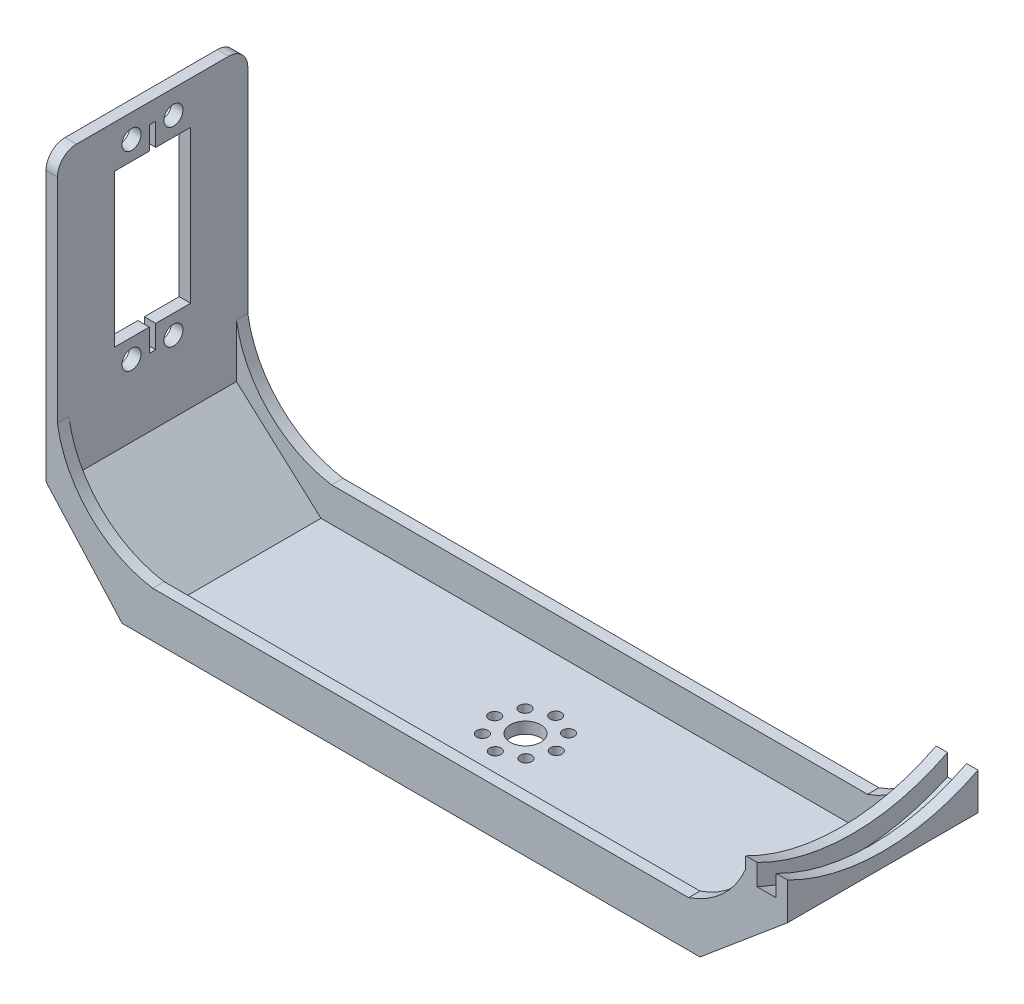
from build123d import *
from OCP.BRepFilletAPI import BRepFilletAPI_MakeChamfer

# Parameters (mm, degrees)
SKETCH1_W           = 194.75
SKETCH1_H           = 50
BOSS_EXTRUDE1_DEPTH = 3
BOSS_EXTRUDE2_START = -3
BOSS_EXTRUDE2_DEPTH = 5
BOSS_EXTRUDE3_DEPTH = 3
BOSS_EXTRUDE4_START = -3
BOSS_EXTRUDE4_DEPTH = 3
SKETCH6_W           = 50
SKETCH6_H           = 95
BOSS_EXTRUDE5_DEPTH = 3
BOSS_EXTRUDE6_REACH = 218.788
SKETCH7_W           = 3
SKETCH7_H           = 9
RIB1_START          = -3
RIB1_DEPTH          = 3
LPATTERN1_COUNT     = 2
LPATTERN1_PITCH     = 47
RIB2_START          = -3
RIB2_DEPTH          = 3
LPATTERN2_COUNT     = 2
LPATTERN2_PITCH     = 47
CUT_EXTRUDE1_REACH  = 178.602
SKETCH10_R          = 4
SKETCH10_R_2        = 1.5
FILLET1_R           = 5
CHAMFER1_SIZE       = 20
CHAMFER1_SIZE2      = 22.212250297
CHAMFER2_SIZE       = 20
CHAMFER2_SIZE2      = 14.004150764
CHAMFER3_SIZE       = 23
CHAMFER3_SIZE2      = 19.299291517
CUT_EXTRUDE2_REACH  = 221.446
SKETCH11_W          = 1.7
SKETCH11_H          = 6
SKETCH11_R          = 2.5


# Read off the part's stored shape, not the designer's step: Rib1, Rib2
with BuildPart() as part:
    # Sketch1 → Boss-Extrude1 (new body)
    with BuildSketch(Plane(origin=(0, 0, 0), x_dir=(1, 0, 0), z_dir=(0, 1, 0))):
        with Locations((49.3836315, 0)):
            Rectangle(SKETCH1_W, SKETCH1_H)
    extrude(amount=BOSS_EXTRUDE1_DEPTH)

    # Sketch2 → Boss-Extrude2 (add)
    with BuildSketch(Plane(origin=(146.7586315, 0, 0), x_dir=(0, 0, -1), z_dir=(1, 0, 0)).offset(BOSS_EXTRUDE2_START)):
        with BuildLine():
            Line((25, 3), (25, 23.456439427))
            ThreePointArc((25, 23.456439427), (0, 18), (-25, 23.456439427))
            Line((-25, 23.456439427), (-25, 3))
            Line((-25, 3), (25, 3))
        make_face()
    extrude(amount=-BOSS_EXTRUDE2_DEPTH)

    # Sketch3 → Boss-Extrude3 (add)
    with BuildSketch(Plane(origin=(143.7586315, 0, 0), x_dir=(0, 0, -1), z_dir=(1, 0, 0))):
        with BuildLine():
            Line((-25, 3), (25, 3))
            Line((25, 3), (25, 29.010205144))
            ThreePointArc((25, 29.010205144), (0, 23), (-25, 29.010205144))
            Line((-25, 29.010205144), (-25, 3))
        make_face()
    extrude(amount=BOSS_EXTRUDE3_DEPTH)

    # Sketch4 → Boss-Extrude4 (add)
    with BuildSketch(Plane(origin=(138.7586315, 0, 0), x_dir=(0, 0, -1), z_dir=(1, 0, 0)).offset(BOSS_EXTRUDE4_START)):
        with BuildLine():
            Line((-25, 0), (-25, 29.010205144))
            ThreePointArc((-25, 29.010205144), (0, 23), (25, 29.010205144))
            Line((25, 29.010205144), (25, 0))
            Line((25, 0), (-25, 0))
        make_face()
    extrude(amount=BOSS_EXTRUDE4_DEPTH)

    # Sketch6 → Boss-Extrude5 (add)
    with BuildSketch(Plane.ZY.offset(47.9913685)):
        with Locations((0, 50.5)):
            Rectangle(SKETCH6_W, SKETCH6_H)
    extrude(amount=-BOSS_EXTRUDE5_DEPTH)

    # Sketch7 → Boss-Extrude6 (add, up to next)
    with BuildSketch(Plane(origin=(-44.9913685, 0, 0), x_dir=(0, 0, -1), z_dir=(1, 0, 0)), mode=Mode.PRIVATE) as boss_extrude6_sk1:
        with Locations((-23.5, 7.5)):
            Rectangle(SKETCH7_W, SKETCH7_H)
    boss_extrude6_tool1 = extrude(boss_extrude6_sk1.sketch, amount=BOSS_EXTRUDE6_REACH, mode=Mode.PRIVATE) - part.part
    # Sketch7 → Boss-Extrude6 (add, up to next)
    with BuildSketch(Plane(origin=(-44.9913685, 0, 0), x_dir=(0, 0, -1), z_dir=(1, 0, 0)), mode=Mode.PRIVATE) as boss_extrude6_sk2:
        with Locations((23.5, 7.5)):
            Rectangle(SKETCH7_W, SKETCH7_H)
    boss_extrude6_tool2 = extrude(boss_extrude6_sk2.sketch, amount=BOSS_EXTRUDE6_REACH, mode=Mode.PRIVATE) - part.part
    add(boss_extrude6_tool1.solids().sort_by_distance((-44.991369, 7.5, 23.5))[0])
    add(boss_extrude6_tool2.solids().sort_by_distance((-44.991369, 7.5, -23.5))[0])

    # Rib1 outline → Rib1 (add)
    with BuildSketch(Plane.XY.offset(25).offset(RIB1_START)):
        with BuildLine():
            ThreePointArc((-19.991368497, 11.999999999), (-36.565435434, 20.425933064), (-44.9913685, 37))
            Line((-44.9913685, 37), (-44.9913685, 12))
            Line((-44.9913685, 12), (-19.991368497, 11.999999999))
        make_face()
    rib1 = extrude(amount=RIB1_DEPTH)

    # LPattern1: Rib1 ×2
    with Locations(*[(0, 0, -i * LPATTERN1_PITCH) for i in range(1, LPATTERN1_COUNT)]):
        add(rib1)

    # Rib2 outline → Rib2 (add)
    with BuildSketch(Plane.XY.offset(25).offset(RIB2_START)):
        with BuildLine():
            ThreePointArc((135.7586315, 26.007069295), (129.762224626, 17.393355072), (120.7586315, 12))
            Line((120.7586315, 12), (135.7586315, 12))
            Line((135.7586315, 12), (135.7586315, 26.007069295))
        make_face()
    rib2 = extrude(amount=RIB2_DEPTH)

    # LPattern2: Rib2 ×2
    with Locations(*[(0, 0, -i * LPATTERN2_PITCH) for i in range(1, LPATTERN2_COUNT)]):
        add(rib2)

    # Sketch10 → Cut-Extrude1 (cut, up to next)
    with BuildSketch(Plane(origin=(0, 3, 0), x_dir=(1, 0, 0), z_dir=(0, 1, 0)), mode=Mode.PRIVATE) as cut_extrude1_sk1:
        with Locations(Location((53.0086315, -0.085435095, 0), (0, 0, 270))):
            Circle(SKETCH10_R)
    cut_extrude1_tool1 = extrude(cut_extrude1_sk1.sketch, amount=-CUT_EXTRUDE1_REACH, mode=Mode.PRIVATE) & part.part
    # Sketch10 → Cut-Extrude1 (cut, up to next)
    with BuildSketch(Plane(origin=(0, 3, 0), x_dir=(1, 0, 0), z_dir=(0, 1, 0)), mode=Mode.PRIVATE) as cut_extrude1_sk2:
        with Locations(Location((61.0086315, -2.1452e-05, 0), (0, 0, 270))):
            Circle(SKETCH10_R_2)
    cut_extrude1_tool2 = extrude(cut_extrude1_sk2.sketch, amount=-CUT_EXTRUDE1_REACH, mode=Mode.PRIVATE) & part.part
    # Sketch10 → Cut-Extrude1 (cut, up to next)
    with BuildSketch(Plane(origin=(0, 3, 0), x_dir=(1, 0, 0), z_dir=(0, 1, 0)), mode=Mode.PRIVATE) as cut_extrude1_sk3:
        with Locations(Location((58.725882315, -5.681892778, 0), (0, 0, 270))):
            Circle(SKETCH10_R_2)
    cut_extrude1_tool3 = extrude(cut_extrude1_sk3.sketch, amount=-CUT_EXTRUDE1_REACH, mode=Mode.PRIVATE) & part.part
    # Sketch10 → Cut-Extrude1 (cut, up to next)
    with BuildSketch(Plane(origin=(0, 3, 0), x_dir=(1, 0, 0), z_dir=(0, 1, 0)), mode=Mode.PRIVATE) as cut_extrude1_sk4:
        with Locations(Location((53.094045142, -8.085435095, 0), (0, 0, 270))):
            Circle(SKETCH10_R_2)
    cut_extrude1_tool4 = extrude(cut_extrude1_sk4.sketch, amount=-CUT_EXTRUDE1_REACH, mode=Mode.PRIVATE) & part.part
    # Sketch10 → Cut-Extrude1 (cut, up to next)
    with BuildSketch(Plane(origin=(0, 3, 0), x_dir=(1, 0, 0), z_dir=(0, 1, 0)), mode=Mode.PRIVATE) as cut_extrude1_sk5:
        with Locations(Location((47.412173816, -5.80268591, 0), (0, 0, 270))):
            Circle(SKETCH10_R_2)
    cut_extrude1_tool5 = extrude(cut_extrude1_sk5.sketch, amount=-CUT_EXTRUDE1_REACH, mode=Mode.PRIVATE) & part.part
    # Sketch10 → Cut-Extrude1 (cut, up to next)
    with BuildSketch(Plane(origin=(0, 3, 0), x_dir=(1, 0, 0), z_dir=(0, 1, 0)), mode=Mode.PRIVATE) as cut_extrude1_sk6:
        with Locations(Location((45.0086315, -0.170848737, 0), (0, 0, 270))):
            Circle(SKETCH10_R_2)
    cut_extrude1_tool6 = extrude(cut_extrude1_sk6.sketch, amount=-CUT_EXTRUDE1_REACH, mode=Mode.PRIVATE) & part.part
    # Sketch10 → Cut-Extrude1 (cut, up to next)
    with BuildSketch(Plane(origin=(0, 3, 0), x_dir=(1, 0, 0), z_dir=(0, 1, 0)), mode=Mode.PRIVATE) as cut_extrude1_sk7:
        with Locations(Location((47.291380684, 5.511022589, 0), (0, 0, 270))):
            Circle(SKETCH10_R_2)
    cut_extrude1_tool7 = extrude(cut_extrude1_sk7.sketch, amount=-CUT_EXTRUDE1_REACH, mode=Mode.PRIVATE) & part.part
    # Sketch10 → Cut-Extrude1 (cut, up to next)
    with BuildSketch(Plane(origin=(0, 3, 0), x_dir=(1, 0, 0), z_dir=(0, 1, 0)), mode=Mode.PRIVATE) as cut_extrude1_sk8:
        with Locations(Location((52.923217857, 7.914564905, 0), (0, 0, 270))):
            Circle(SKETCH10_R_2)
    cut_extrude1_tool8 = extrude(cut_extrude1_sk8.sketch, amount=-CUT_EXTRUDE1_REACH, mode=Mode.PRIVATE) & part.part
    # Sketch10 → Cut-Extrude1 (cut, up to next)
    with BuildSketch(Plane(origin=(0, 3, 0), x_dir=(1, 0, 0), z_dir=(0, 1, 0)), mode=Mode.PRIVATE) as cut_extrude1_sk9:
        with Locations(Location((58.605089183, 5.631815721, 0), (0, 0, 270))):
            Circle(SKETCH10_R_2)
    cut_extrude1_tool9 = extrude(cut_extrude1_sk9.sketch, amount=-CUT_EXTRUDE1_REACH, mode=Mode.PRIVATE) & part.part
    add(cut_extrude1_tool1.solids().sort_by_distance((53.008631, 3, 0.085435))[0], mode=Mode.SUBTRACT)
    add(cut_extrude1_tool2.solids().sort_by_distance((61.008631, 3, 2.1e-05))[0], mode=Mode.SUBTRACT)
    add(cut_extrude1_tool3.solids().sort_by_distance((58.725882, 3, 5.681893))[0], mode=Mode.SUBTRACT)
    add(cut_extrude1_tool4.solids().sort_by_distance((53.094045, 3, 8.085435))[0], mode=Mode.SUBTRACT)
    add(cut_extrude1_tool5.solids().sort_by_distance((47.412174, 3, 5.802686))[0], mode=Mode.SUBTRACT)
    add(cut_extrude1_tool6.solids().sort_by_distance((45.008631, 3, 0.170849))[0], mode=Mode.SUBTRACT)
    add(cut_extrude1_tool7.solids().sort_by_distance((47.291381, 3, -5.511023))[0], mode=Mode.SUBTRACT)
    add(cut_extrude1_tool8.solids().sort_by_distance((52.923218, 3, -7.914565))[0], mode=Mode.SUBTRACT)
    add(cut_extrude1_tool9.solids().sort_by_distance((58.605089, 3, -5.631816))[0], mode=Mode.SUBTRACT)

    # Fillet1
    fillet1_edges = [part.edges().sort_by_distance(p)[0] for p in [
        (-46.4913685, 98, 25),
        (-46.4913685, 98, -25),
    ]]
    fillet(fillet1_edges, radius=FILLET1_R)

    # Chamfer1: one chamfer whose edges measure the first distance from different faces: ONE call of the kernel's chamfer builder (chamfer() names one face for all edges)
    chamfer1_edges_1 = [part.edges().sort_by_distance(p)[0] for p in [
        (-47.9913685, 0, 0),
    ]]
    chamfer1_side_1 = [part.faces().sort_by_distance(p)[0] for p in [
        (-45.98070785, 0, 0),
    ]]
    chamfer1_edges_2 = [part.edges().sort_by_distance(p)[0] for p in [
        (-44.9913685, 3, 0),
    ]]
    chamfer1_side_2 = [part.faces().sort_by_distance(p)[0] for p in [
        (-44.9913685, 51.76217503, 0),
    ]]
    chamfer1 = BRepFilletAPI_MakeChamfer(part.part.solid().wrapped)
    for e in chamfer1_edges_1:
        chamfer1.Add(CHAMFER1_SIZE, CHAMFER1_SIZE2, e.wrapped, chamfer1_side_1[0].wrapped)  # the first distance lies on this face
    for e in chamfer1_edges_2:
        chamfer1.Add(CHAMFER1_SIZE, CHAMFER1_SIZE2, e.wrapped, chamfer1_side_2[0].wrapped)  # the first distance lies on this face
    add(Compound.cast(chamfer1.Shape()), mode=Mode.REPLACE)

    # Chamfer2
    chamfer2_edges = [part.edges().sort_by_distance(p)[0] for p in [
        (135.7586315, 3, 0),
    ]]
    chamfer2_side = [part.faces().sort_by_distance(p)[0] for p in [
        (56.489756648, 3, -20.354697047),
    ]]
    chamfer(chamfer2_edges, length=CHAMFER2_SIZE, length2=CHAMFER2_SIZE2, reference=chamfer2_side[0])

    # Chamfer3
    chamfer3_edges = [part.edges().sort_by_distance(p)[0] for p in [
        (146.7586315, 0, 0),
    ]]
    chamfer3_side = [part.faces().sort_by_distance(p)[0] for p in [
        (59.462529077, 0, -0.001057352),
    ]]
    chamfer(chamfer3_edges, length=CHAMFER3_SIZE, length2=CHAMFER3_SIZE2, reference=chamfer3_side[0])

    # Sketch11 → Cut-Extrude2 (cut, up to next)
    with BuildSketch(Plane.ZY.offset(47.9913685), mode=Mode.PRIVATE) as cut_extrude2_sk1:
        with Locations((0.032606221, 89.827764741)):
            Rectangle(SKETCH11_W, SKETCH11_H)
    cut_extrude2_tool1 = extrude(cut_extrude2_sk1.sketch, amount=-CUT_EXTRUDE2_REACH, mode=Mode.PRIVATE) & part.part
    # Sketch11 → Cut-Extrude2 (cut, up to next)
    with BuildSketch(Plane.ZY.offset(47.9913685), mode=Mode.PRIVATE) as cut_extrude2_sk2:
        Polygon((0.882606221, 86.827764741), (-0.817393779, 86.827764741), (-9.967393779, 86.827764741), (-9.967393779, 46.827764741), (-0.817393779, 46.827764741), (0.882606221, 46.827764741), (10.032606221, 46.827764741), (10.032606221, 86.827764741), align=None)
    cut_extrude2_tool2 = extrude(cut_extrude2_sk2.sketch, amount=-CUT_EXTRUDE2_REACH, mode=Mode.PRIVATE) & part.part
    # Sketch11 → Cut-Extrude2 (cut, up to next)
    with BuildSketch(Plane.ZY.offset(47.9913685), mode=Mode.PRIVATE) as cut_extrude2_sk3:
        with Locations((-5.467393779, 91.827764741)):
            Circle(SKETCH11_R)
    cut_extrude2_tool3 = extrude(cut_extrude2_sk3.sketch, amount=-CUT_EXTRUDE2_REACH, mode=Mode.PRIVATE) & part.part
    # Sketch11 → Cut-Extrude2 (cut, up to next)
    with BuildSketch(Plane.ZY.offset(47.9913685), mode=Mode.PRIVATE) as cut_extrude2_sk4:
        with Locations((5.532606221, 91.827764741)):
            Circle(SKETCH11_R)
    cut_extrude2_tool4 = extrude(cut_extrude2_sk4.sketch, amount=-CUT_EXTRUDE2_REACH, mode=Mode.PRIVATE) & part.part
    # Sketch11 → Cut-Extrude2 (cut, up to next)
    with BuildSketch(Plane.ZY.offset(47.9913685), mode=Mode.PRIVATE) as cut_extrude2_sk5:
        with Locations((0.032606221, 43.827764741)):
            Rectangle(SKETCH11_W, SKETCH11_H)
    cut_extrude2_tool5 = extrude(cut_extrude2_sk5.sketch, amount=-CUT_EXTRUDE2_REACH, mode=Mode.PRIVATE) & part.part
    # Sketch11 → Cut-Extrude2 (cut, up to next)
    with BuildSketch(Plane.ZY.offset(47.9913685), mode=Mode.PRIVATE) as cut_extrude2_sk6:
        with Locations((-5.467393779, 41.827764741)):
            Circle(SKETCH11_R)
    cut_extrude2_tool6 = extrude(cut_extrude2_sk6.sketch, amount=-CUT_EXTRUDE2_REACH, mode=Mode.PRIVATE) & part.part
    # Sketch11 → Cut-Extrude2 (cut, up to next)
    with BuildSketch(Plane.ZY.offset(47.9913685), mode=Mode.PRIVATE) as cut_extrude2_sk7:
        with Locations((5.532606221, 41.827764741)):
            Circle(SKETCH11_R)
    cut_extrude2_tool7 = extrude(cut_extrude2_sk7.sketch, amount=-CUT_EXTRUDE2_REACH, mode=Mode.PRIVATE) & part.part
    add(cut_extrude2_tool1.solids().sort_by_distance((-47.991369, 89.827765, 0.032606))[0], mode=Mode.SUBTRACT)
    add(cut_extrude2_tool2.solids().sort_by_distance((-47.991369, 66.827765, 0.032606))[0], mode=Mode.SUBTRACT)
    add(cut_extrude2_tool3.solids().sort_by_distance((-47.991369, 91.827765, -5.467394))[0], mode=Mode.SUBTRACT)
    add(cut_extrude2_tool4.solids().sort_by_distance((-47.991369, 91.827765, 5.532606))[0], mode=Mode.SUBTRACT)
    add(cut_extrude2_tool5.solids().sort_by_distance((-47.991369, 43.827765, 0.032606))[0], mode=Mode.SUBTRACT)
    add(cut_extrude2_tool6.solids().sort_by_distance((-47.991369, 41.827765, -5.467394))[0], mode=Mode.SUBTRACT)
    add(cut_extrude2_tool7.solids().sort_by_distance((-47.991369, 41.827765, 5.532606))[0], mode=Mode.SUBTRACT)


solid = part.part
